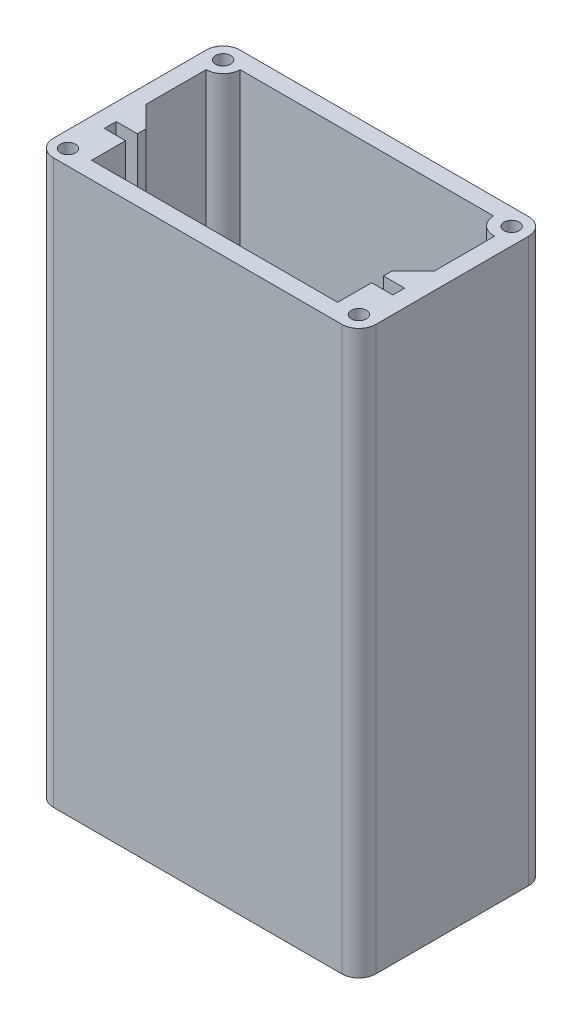
from build123d import *
from OCP.BRepFilletAPI import BRepFilletAPI_MakeChamfer

# Parameters (mm, degrees)
SKETCH1_W                       = 48.26
SKETCH1_H                       = 27.94
BOSS_EXTRUDE1_DEPTH             = 85.09
CUT_EXTRUDE1_DEPTH              = 82.55
F_43_0_089_DIAMETER_HOLE1_D     = 2.2606
F_43_0_089_DIAMETER_HOLE1_DEPTH = 19.05
F_43_0_089_DIAMETER_HOLE1_TIP   = 0.679152758
SKETCH4_W                       = 16.51
SKETCH4_H                       = 8.89
CUT_EXTRUDE2_DEPTH              = 88.13162629
CHAMFER1_SIZE                   = 3.81
FILLET1_R                       = 2.54
CHAMFER2_SIZE                   = 1.27
CHAMFER2_SIZE2                  = 0.889263574


with BuildPart() as part:
    # Sketch1 → Boss-Extrude1 (new body)
    with BuildSketch(Plane(origin=(0, 0, 0), x_dir=(1, 0, 0), z_dir=(0, 1, 0))):
        Rectangle(SKETCH1_W, SKETCH1_H)
    extrude(amount=BOSS_EXTRUDE1_DEPTH)

    # Sketch3 → Cut-Extrude1 (cut)
    with BuildSketch(Plane(origin=(0, 85.09, 0), x_dir=(1, 0, 0), z_dir=(0, 1, 0))):
        with BuildLine():
            Line((21.59, 0.508), (18.415, 0.508))
            Line((18.415, 0.508), (18.415, -4.572))
            Line((18.415, -4.572), (21.59, -4.572))
            Line((21.59, -4.572), (21.59, -6.35))
            Line((21.59, -6.35), (18.415, -6.35))
            Line((18.415, -6.35), (18.415, -11.43))
            Line((18.415, -11.43), (-18.415, -11.43))
            Line((-18.415, -11.43), (-18.415, -6.35))
            Line((-18.415, -6.35), (-21.59, -6.35))
            Line((-21.59, -6.35), (-21.59, -4.572))
            Line((-21.59, -4.572), (-18.415, -4.572))
            Line((-18.415, -4.572), (-18.415, 0.508))
            Line((-18.415, 0.508), (-21.59, 0.508))
            Line((-21.59, 0.508), (-21.59, 8.89))
            ThreePointArc((-21.59, 8.89), (-19.793948776, 9.633948776), (-19.05, 11.43))
            Line((-19.05, 11.43), (18.895098563, 11.43))
            ThreePointArc((18.895098563, 11.43), (19.694674714, 9.57999329), (21.59, 8.894727718))
            Line((21.59, 8.894727718), (21.59, 0.508))
        make_face()
    extrude(amount=-CUT_EXTRUDE1_DEPTH, mode=Mode.SUBTRACT)

    # #43 (0.089) Diameter Hole1
    with Locations(Plane(origin=(0, 85.09, 0), x_dir=(1, 0, 0), z_dir=(0, 1, 0))):
        with Locations((-21.59, 11.43), (21.59, 11.43), (21.59, -11.43), (-21.705255142, -11.683941121)):
            Hole(F_43_0_089_DIAMETER_HOLE1_D / 2, depth=F_43_0_089_DIAMETER_HOLE1_DEPTH)
            with Locations((0, 0, -(F_43_0_089_DIAMETER_HOLE1_DEPTH + F_43_0_089_DIAMETER_HOLE1_TIP / 2))):  # 118° drill point
                Cone(0, F_43_0_089_DIAMETER_HOLE1_D / 2, F_43_0_089_DIAMETER_HOLE1_TIP, mode=Mode.SUBTRACT)

    # Sketch4 → Cut-Extrude2 (cut, through all)
    with BuildSketch(Plane(origin=(0, 2.54, 0), x_dir=(1, 0, 0), z_dir=(0, 1, 0))):
        with Locations((0, -0.127)):
            Rectangle(SKETCH4_W, SKETCH4_H)
    extrude(amount=-CUT_EXTRUDE2_DEPTH, mode=Mode.SUBTRACT)

    # Chamfer1
    # the kernel refuses this chamfer: 3.81 mm, written as the material it takes off along each edge
    with BuildSketch(Plane(origin=(18.415, 94.888112184, -0.508), x_dir=(0.9996219169112968, 0, -0.027495876610586445), z_dir=(0, -1, 0))) as chamfer1_piece_1_section:
        Polygon((CHAMFER1_SIZE * 0.999621916911, CHAMFER1_SIZE * 0.0274958766106), (-CHAMFER1_SIZE * 0.0274958766106, CHAMFER1_SIZE * 0.999621916911), (0, 0), align=None)
    chamfer1_piece_1 = extrude(amount=92.348112184, mode=Mode.PRIVATE)
    chamfer1_piece_1 = split(chamfer1_piece_1, bisect_by=Plane(origin=(21.59, 43.815, 0.792238095), z_dir=(-1, 0, 0)), keep=Keep.TOP, mode=Mode.PRIVATE)
    add(chamfer1_piece_1, mode=Mode.SUBTRACT)
    with BuildSketch(Plane(origin=(-18.415, 94.888112184, -0.508), x_dir=(-0.9996219169112968, 0, -0.027495876610586247), z_dir=(0, -1, 0))) as chamfer1_piece_2_section:
        Polygon((CHAMFER1_SIZE * 0.999621916911, -CHAMFER1_SIZE * 0.0274958766106), (-CHAMFER1_SIZE * 0.0274958766106, -CHAMFER1_SIZE * 0.999621916911), (0, 0), align=None)
    chamfer1_piece_2 = extrude(amount=92.348112184, mode=Mode.PRIVATE)
    chamfer1_piece_2 = split(chamfer1_piece_2, bisect_by=Plane(origin=(-21.59, 43.815, 0.792238095), z_dir=(1, 0, 0)), keep=Keep.TOP, mode=Mode.PRIVATE)
    add(chamfer1_piece_2, mode=Mode.SUBTRACT)

    # Fillet1
    fillet1_edges = [part.edges().sort_by_distance(p)[0] for p in [
        (24.13, 42.545, 13.97),
        (-24.13, 42.545, 13.97),
        (-24.13, 42.545, -13.97),
        (24.13, 42.545, -13.97),
    ]]
    fillet(fillet1_edges, radius=FILLET1_R)

    # Chamfer2: one chamfer whose edges measure the first distance from different faces: ONE call of the kernel's chamfer builder (chamfer() names one face for all edges)
    chamfer2_edges_1 = [part.edges().sort_by_distance(p)[0] for p in [
        (0, 0, 13.97),
        (24.13, 0, 0),
        (-24.13, 0, 0),
        (0, 0, -13.97),
        (-23.386051224, 0, -13.226051224),
        (23.386051224, 0, -13.226051224),
        (23.386051224, 0, 13.226051224),
        (-23.386051224, 0, 13.226051224),
    ]]
    chamfer2_side_1 = [part.faces().sort_by_distance(p)[0] for p in [
        (0, 0, 13.412355741),
    ]]
    chamfer2_edges_2 = [part.edges().sort_by_distance(p)[0] for p in [
        (8.255, 0, 0.127),
    ]]
    chamfer2_side_2 = [part.faces().sort_by_distance(p)[0] for p in [
        (8.255, 1.27, 0.127),
    ]]
    chamfer2_edges_3 = [part.edges().sort_by_distance(p)[0] for p in [
        (0, 0, 4.572),
    ]]
    chamfer2_side_3 = [part.faces().sort_by_distance(p)[0] for p in [
        (0, 1.27, 4.572),
    ]]
    chamfer2_edges_4 = [part.edges().sort_by_distance(p)[0] for p in [
        (-8.255, 0, 0.127),
    ]]
    chamfer2_side_4 = [part.faces().sort_by_distance(p)[0] for p in [
        (-8.255, 1.27, 0.127),
    ]]
    chamfer2_edges_5 = [part.edges().sort_by_distance(p)[0] for p in [
        (0, 0, -4.318),
    ]]
    chamfer2_side_5 = [part.faces().sort_by_distance(p)[0] for p in [
        (0, 1.27, -4.318),
    ]]
    chamfer2 = BRepFilletAPI_MakeChamfer(part.part.solid().wrapped)
    for e in chamfer2_edges_1:
        chamfer2.Add(CHAMFER2_SIZE, CHAMFER2_SIZE2, e.wrapped, chamfer2_side_1[0].wrapped)  # the first distance lies on this face
    for e in chamfer2_edges_2:
        chamfer2.Add(CHAMFER2_SIZE, CHAMFER2_SIZE2, e.wrapped, chamfer2_side_2[0].wrapped)  # the first distance lies on this face
    for e in chamfer2_edges_3:
        chamfer2.Add(CHAMFER2_SIZE, CHAMFER2_SIZE2, e.wrapped, chamfer2_side_3[0].wrapped)  # the first distance lies on this face
    for e in chamfer2_edges_4:
        chamfer2.Add(CHAMFER2_SIZE, CHAMFER2_SIZE2, e.wrapped, chamfer2_side_4[0].wrapped)  # the first distance lies on this face
    for e in chamfer2_edges_5:
        chamfer2.Add(CHAMFER2_SIZE, CHAMFER2_SIZE2, e.wrapped, chamfer2_side_5[0].wrapped)  # the first distance lies on this face
    add(Compound.cast(chamfer2.Shape()), mode=Mode.REPLACE)


solid = part.part
